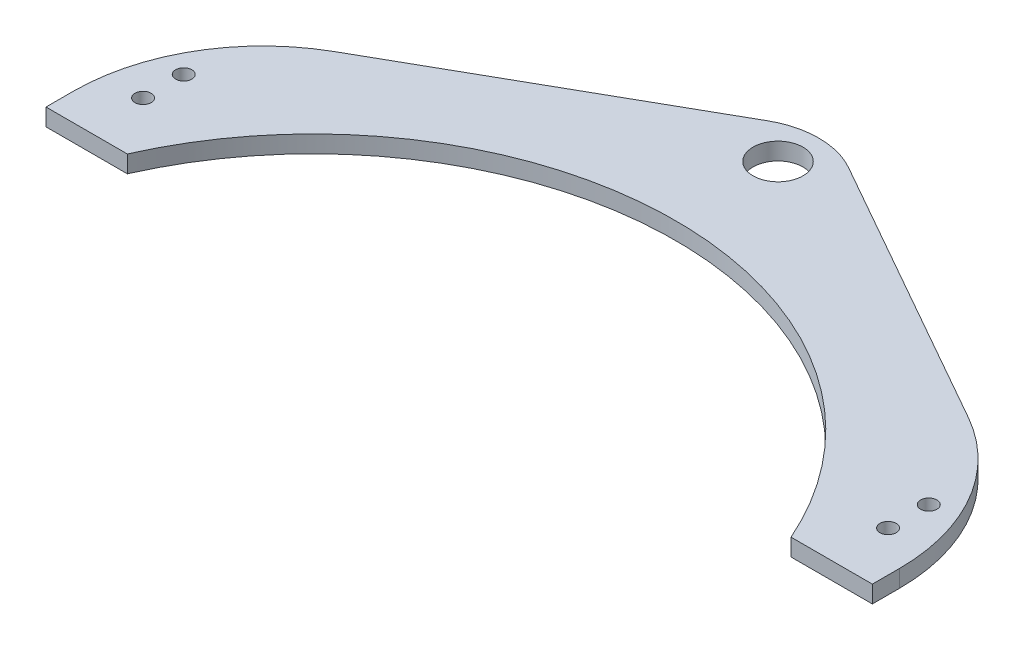
from build123d import *

# Parameters (mm, degrees)
SKETCH1_R           = 4.6
SKETCH1_R_2         = 1.5
BOSS_EXTRUDE2_DEPTH = 3.175


with BuildPart() as part:
    # Sketch1 → Boss-Extrude2 (new body)
    with BuildSketch(Plane(origin=(0, 0, 0), x_dir=(1, 0, 0), z_dir=(0, 1, 0))):
        with BuildLine():
            Line((-7.5, 0), (0, 0))
            ThreePointArc((0, 0), (61.2, 39.907584028), (122.4, 0))
            Line((122.4, 0), (129.9, 0))
            Line((129.9, 0), (137.4, 0))
            Line((137.4, 0), (137.4, 5.001196831))
            ThreePointArc((137.4, 5.001196831), (132.638976527, 22.625166265), (119.651182936, 35.45438529))
            Line((119.651182936, 35.45438529), (68.639886063, 64.351366482))
            ThreePointArc((68.639886063, 64.351366482), (65.069446402, 65.804662996), (61.246521948, 66.3))
            Line((61.246521948, 66.3), (61.153478052, 66.3))
            ThreePointArc((61.153478052, 66.3), (57.330553598, 65.804662996), (53.760113937, 64.351366482))
            Line((53.760113937, 64.351366482), (2.748817064, 35.45438529))
            ThreePointArc((2.748817064, 35.45438529), (-10.238976527, 22.625166265), (-15, 5.001196831))
            Line((-15, 5.001196831), (-15, 0))
            Line((-15, 0), (-7.5, 0))
        make_face()
        with Locations((61.2, 58.8)):
            Circle(SKETCH1_R, mode=Mode.SUBTRACT)
        with BuildLine():
            ThreePointArc((-7.5, 8.9), (-9, 10.4), (-7.5, 11.9))
            ThreePointArc((-7.5, 11.9), (-6, 10.4), (-7.5, 8.9))
        make_face(mode=Mode.SUBTRACT)
        with Locations((-7.5, 17.9)):
            Circle(SKETCH1_R_2, mode=Mode.SUBTRACT)
        with BuildLine():
            ThreePointArc((129.9, 8.9), (128.4, 10.4), (129.9, 11.9))
            ThreePointArc((129.9, 11.9), (131.4, 10.4), (129.9, 8.9))
        make_face(mode=Mode.SUBTRACT)
        with Locations((129.9, 17.9)):
            Circle(SKETCH1_R_2, mode=Mode.SUBTRACT)
    extrude(amount=BOSS_EXTRUDE2_DEPTH)


solid = part.part
